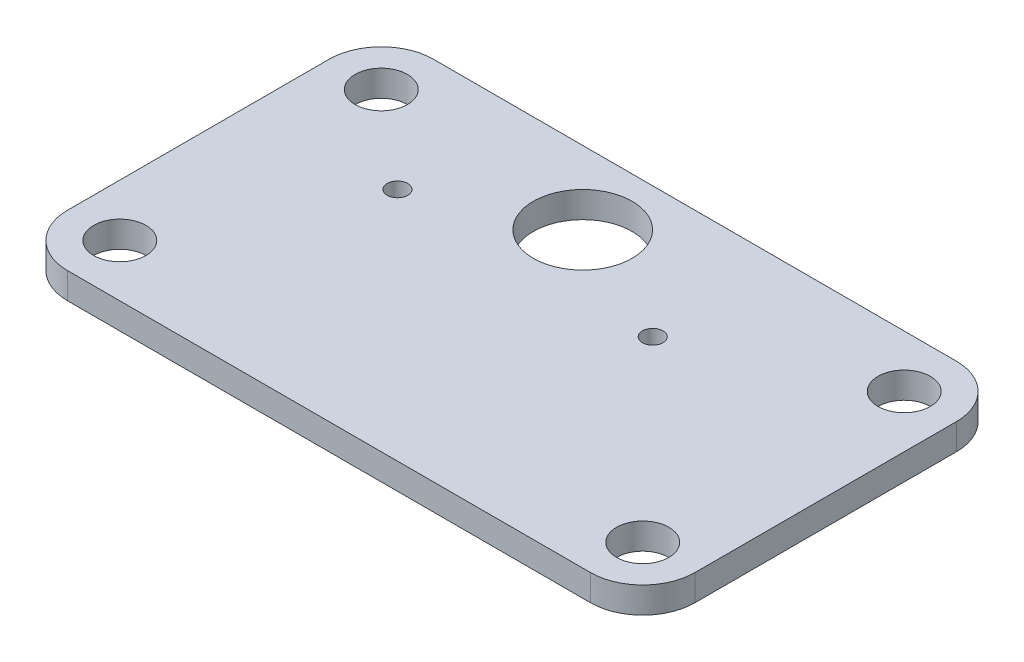
from build123d import *

# Parameters (mm, degrees)
BASE_FLANGE1_DEPTH = 3.175
SKETCH6_R          = 3.175
SKETCH6_R_2        = 6
SKETCH6_R_3        = 1.25
CUT_EXTRUDE1_DEPTH = 52.612064057


# Sheet-metal steps are written as plain solids
with BuildPart() as part:
    # Sketch1 → Base-Flange1 (new body)
    with BuildSketch(Plane(origin=(0, 0, 0), x_dir=(1, 0, 0), z_dir=(0, 1, 0))):
        with BuildLine():
            Line((36.5125, -28.575), (-26.9875, -28.575))
            ThreePointArc((-26.9875, -28.575), (-31.477628061, -26.715128061), (-33.3375, -22.225))
            Line((-33.3375, -22.225), (-33.3375, 9.525))
            ThreePointArc((-33.3375, 9.525), (-31.477628061, 14.015128061), (-26.9875, 15.875))
            Line((-26.9875, 15.875), (36.5125, 15.875))
            ThreePointArc((36.5125, 15.875), (41.002628061, 14.015128061), (42.8625, 9.525))
            Line((42.8625, 9.525), (42.8625, -22.225))
            ThreePointArc((42.8625, -22.225), (41.002628061, -26.715128061), (36.5125, -28.575))
        make_face()
    extrude(amount=-BASE_FLANGE1_DEPTH)

    # Sketch6 → Cut-Extrude1 (cut, through all)
    with BuildSketch(Plane(origin=(0, 0, 0), x_dir=(1, 0, 0), z_dir=(0, 1, 0))):
        with Locations(Location((-26.9875, 9.525, 0), (0, 0, 270))):
            Circle(SKETCH6_R)
        with Locations(Location((-26.9875, -22.225, 0), (0, 0, 270))):
            Circle(SKETCH6_R)
        with Locations(Location((36.5125, 9.525, 0), (0, 0, 270))):
            Circle(SKETCH6_R)
        with Locations(Location((36.5125, -22.225, 0), (0, 0, 270))):
            Circle(SKETCH6_R)
        with Locations(Location((0, 7, 0), (0, 0, 270))):
            Circle(SKETCH6_R_2)
        with Locations(Location((-15.5, 0, 0), (0, 0, 270))):
            Circle(SKETCH6_R_3)
        with Locations(Location((15.5, 0, 0), (0, 0, 270))):
            Circle(SKETCH6_R_3)
    extrude(amount=-CUT_EXTRUDE1_DEPTH, mode=Mode.SUBTRACT)


solid = part.part
